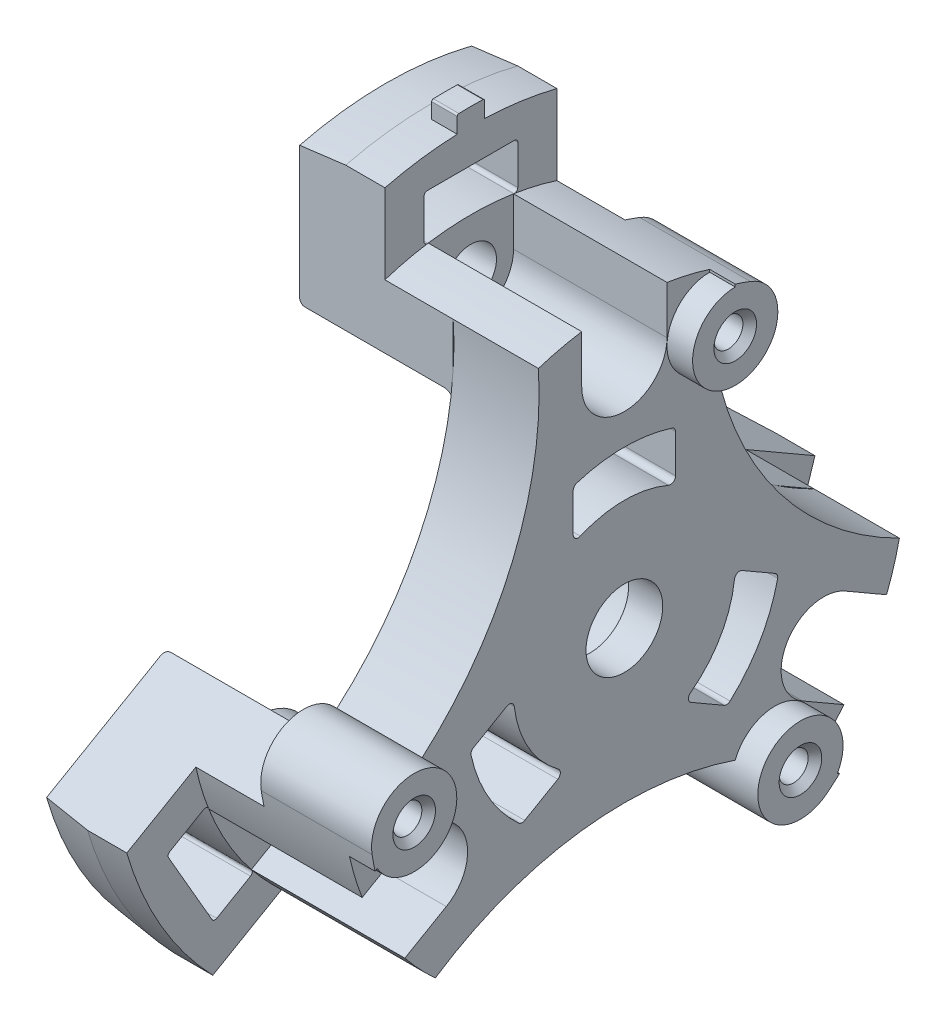
from build123d import *
from build123d.topology import SkipClean

# Parameters (mm, degrees)
SKETCH_2_R                           = 20
CUT_EXTRUDE_1_DEPTH                  = 10
PATTERN_CIRCULAR_1_COUNT             = 3
CUT_EXTRUDE_START                    = -10
CUT_EXTRUDE_2_DEPTH                  = 10
PATTERN_CIRCULAR_2_COUNT             = 3
SKETCH_4_R                           = 1.5
EXTRUDE_1_DEPTH                      = 9
PATTERN_CIRCULAR_3_COUNT             = 3
CUT_EXTRUDE_START_2                  = -1.7
CUT_EXTRUDE_3_DEPTH                  = 1.7
CUT_EXTRUDE_START_3                  = -2.5
CUT_EXTRUDE_8_DEPTH                  = 2.5
PATTERN_CIRCULAR_4_COUNT             = 3
CUT_EXTRUDE_4_DEPTH                  = 9
PATTERN_CIRCULAR_5_COUNT             = 3
EXTRUDE_START                        = -6.5
EXTRUDE_2_DEPTH                      = 6.5
SKETCH_9_R                           = 0.85
CUT_EXTRUDE_7_DEPTH                  = 6.4
CHAMFER_3_SIZE                       = 0.4
PATTERN_CIRCULAR_8_COUNT             = 3
CHAMFER_3_OF_PATTERN_CIRCULAR_8_SIZE = 0.4
CHAMFER_4_SIZE                       = 0.35
CHAMFER_4_SIZE2                      = 0.606217783
FILLET_6_R                           = 0.5
FILLET_7_R                           = 0.5
EXTRUDE_START_2                      = -5
EXTRUDE_3_DEPTH                      = 5
PATTERN_CIRCULAR_9_COUNT             = 3
EXTRUDE_4_DEPTH                      = 1.5
FILLET_9_R                           = 0.3
FILLET_10_R                          = 0.2
FILLET_11_R                          = 0.2


with BuildPart() as part:
    # 草图1 → 旋转1 (revolve)
    with BuildSketch(Plane.XY, mode=Mode.PRIVATE) as revolve_1_sk:
        Polygon((-7, 6.5), (-5, 6.5), (-5, 16.5), (0, 16.5), (0, 2.25), (-2, 2.25), (-2, 4), (-7, 4), align=None)
    revolve(revolve_1_sk.sketch.rotate(Axis((-65.742857143, 0, 0), (1, 0, 0)), 90), axis=Axis((-65.742857143, 0, 0), (1, 0, 0)))

    # 草图2 → 切除-拉伸1 (cut)
    with BuildSketch(Plane.ZY.offset(5)):
        with Locations((-25, 14.43375673)):
            Circle(SKETCH_2_R)
    cut_extrude_1 = extrude(amount=-CUT_EXTRUDE_1_DEPTH, mode=Mode.SUBTRACT)

    # 阵列(圆周)1: 切除-拉伸1 ×3 about axis
    pattern_circular_1_axis = Axis((0, 0, 0), (1, 0, 0))
    for i in range(1, PATTERN_CIRCULAR_1_COUNT):
        add(cut_extrude_1.rotate(pattern_circular_1_axis, i * 360 / PATTERN_CIRCULAR_1_COUNT), mode=Mode.SUBTRACT)

    # 草图3 → 切除-拉伸2 (cut)
    with BuildSketch(Plane.ZY.offset(5).offset(CUT_EXTRUDE_START)):
        with BuildLine():
            Line((-3, 8.480566019), (-3, 6.240993511))
            ThreePointArc((-3, 6.240993511), (-2.864719012, 5.990259295), (-2.580882353, 5.965655562))
            ThreePointArc((-2.580882353, 5.965655562), (0, 6.5), (2.580882353, 5.965655562))
            ThreePointArc((2.580882353, 5.965655562), (2.864719012, 5.990259295), (3, 6.240993511))
            Line((3, 6.240993511), (3, 8.480566019))
            ThreePointArc((3, 8.480566019), (2.9421811, 8.657620571), (2.791011236, 8.766427795))
            ThreePointArc((2.791011236, 8.766427795), (0, 9.2), (-2.791011236, 8.766427795))
            ThreePointArc((-2.791011236, 8.766427795), (-2.9421811, 8.657620571), (-3, 8.480566019))
        make_face()
    cut_extrude_2 = extrude(amount=CUT_EXTRUDE_2_DEPTH, mode=Mode.SUBTRACT)

    # 阵列(圆周)2: 切除-拉伸2 ×3 about axis
    pattern_circular_2_axis = Axis((0, 0, 0), (1, 0, 0))
    for i in range(1, PATTERN_CIRCULAR_2_COUNT):
        add(cut_extrude_2.rotate(pattern_circular_2_axis, i * 360 / PATTERN_CIRCULAR_2_COUNT), mode=Mode.SUBTRACT)

    # 草图4 → 凸台-拉伸1 (add)
    with BuildSketch(Plane.ZY.offset(5)):
        with BuildLine():
            Line((-5.040834524, 15.711142139), (-5.040834524, 11.98290396))
            ThreePointArc((-5.040834524, 11.98290396), (-4.096768005, 12.337604788), (-3.128046355, 12.618055556))
            ThreePointArc((-3.128046355, 12.618055556), (0, 10.25), (3.128046355, 12.618055556))
            ThreePointArc((3.128046355, 12.618055556), (4.096768005, 12.337604788), (5.040834524, 11.98290396))
            Line((5.040834524, 11.98290396), (5.040834524, 15.711142139))
            ThreePointArc((5.040834524, 15.711142139), (0, 16.5), (-5.040834524, 15.711142139))
        make_face()
        with Locations((0, 13.5)):
            Circle(SKETCH_4_R, mode=Mode.SUBTRACT)
    extrude_1 = extrude(amount=EXTRUDE_1_DEPTH)

    # 阵列(圆周)3: 凸台-拉伸1 ×3 about axis
    pattern_circular_3_axis = Axis((0, 0, 0), (1, 0, 0))
    for i in range(1, PATTERN_CIRCULAR_3_COUNT):
        add(extrude_1.rotate(pattern_circular_3_axis, i * 360 / PATTERN_CIRCULAR_3_COUNT))

    # 草图5 → 切除-拉伸3 (cut)
    with BuildSketch(Plane.ZY.offset(14).offset(CUT_EXTRUDE_START_2)):
        with BuildLine():
            Line((-3.25, 12.587195875), (-3.25, 9.290818443))
            Line((-3.25, 9.290818443), (3.25, 9.290818443))
            Line((3.25, 9.290818443), (3.25, 12.587195875))
            ThreePointArc((3.25, 12.587195875), (0, 13), (-3.25, 12.587195875))
        make_face()
    cut_extrude_3 = extrude(amount=CUT_EXTRUDE_3_DEPTH, mode=Mode.SUBTRACT)

    # 草图16 → 切除-拉伸8 (cut)
    with BuildSketch(Plane.ZY.offset(12.3).offset(CUT_EXTRUDE_START_3)):
        with BuildLine():
            ThreePointArc((-2.590612577, 12.739259259), (0, 10.8), (2.590612577, 12.739259259))
            ThreePointArc((2.590612577, 12.739259259), (2.859971605, 12.681504738), (3.128046355, 12.618055556))
            ThreePointArc((3.128046355, 12.618055556), (0, 10.25), (-3.128046355, 12.618055556))
            ThreePointArc((-3.128046355, 12.618055556), (-2.859971605, 12.681504738), (-2.590612577, 12.739259259))
        make_face()
    cut_extrude_8 = extrude(amount=CUT_EXTRUDE_8_DEPTH, mode=Mode.SUBTRACT)

    # 阵列(圆周)4: 切除-拉伸3, 切除-拉伸8 ×3 about axis
    pattern_circular_4_axis = Axis((0, 0, 0), (1, 0, 0))
    add([cut_extrude_3.rotate(pattern_circular_4_axis, i * 360 / PATTERN_CIRCULAR_4_COUNT) for i in range(1, PATTERN_CIRCULAR_4_COUNT)], mode=Mode.SUBTRACT)
    add([cut_extrude_8.rotate(pattern_circular_4_axis, i * 360 / PATTERN_CIRCULAR_4_COUNT) for i in range(1, PATTERN_CIRCULAR_4_COUNT)], mode=Mode.SUBTRACT)

    # 草图6 → 切除-拉伸4 (cut)
    with BuildSketch(Plane(origin=(0, 0, 0), x_dir=(0, 0, -1), z_dir=(1, 0, 0))):
        with BuildLine():
            Line((-2.5, 16.30950643), (-2.5, 13.5))
            ThreePointArc((-2.5, 13.5), (0, 11), (2.5, 13.5))
            Line((2.5, 13.5), (2.5, 16.30950643))
            ThreePointArc((2.5, 16.30950643), (0, 16.5), (-2.5, 16.30950643))
        make_face()
    cut_extrude_4 = extrude(amount=-CUT_EXTRUDE_4_DEPTH, mode=Mode.SUBTRACT)

    # 阵列(圆周)5: 切除-拉伸4 ×3 about axis
    pattern_circular_5_axis = Axis((0, 0, 0), (1, 0, 0))
    for i in range(1, PATTERN_CIRCULAR_5_COUNT):
        add(cut_extrude_4.rotate(pattern_circular_5_axis, i * 360 / PATTERN_CIRCULAR_5_COUNT), mode=Mode.SUBTRACT)

    # 草图7 → 凸台-拉伸2 (add)
    with BuildSketch(Plane.ZY.offset(5).offset(EXTRUDE_START)):
        with BuildLine():
            Line((-5, 15.576696831), (-5, 15.724185194))
            ThreePointArc((-5, 15.724185194), (-5.448667451, 15.574402814), (-5.892857143, 15.411821265))
            ThreePointArc((-5.892857143, 15.411821265), (-4.546023726, 10.618261242), (-5, 15.576696831))
        make_face()
    extrude_2 = extrude(amount=EXTRUDE_2_DEPTH)

    # 草图9 → 切除-拉伸7 (cut)
    with SkipClean():  # the faces are left unmerged after this step: merging them gives an invalid solid
        with BuildSketch(Plane(origin=(1.5, 0, 0), x_dir=(0, 0, -1), z_dir=(1, 0, 0))):
            with Locations((5, 13.076696831)):
                Circle(SKETCH_9_R)
        cut_extrude_7 = extrude(amount=-CUT_EXTRUDE_7_DEPTH, mode=Mode.SUBTRACT)

    # 倒角3
    chamfer_3_edges = [part.edges().sort_by_distance(p)[0] for p in [
        (1.5, 13.076696831, -4.15),
    ]]
    chamfer(chamfer_3_edges, length=CHAMFER_3_SIZE)

    # 阵列(圆周)8: 凸台-拉伸2, 切除-拉伸7 ×3 about axis
    with SkipClean():  # the faces are left unmerged after this step: merging them gives an invalid solid
        pattern_circular_8_axis = Axis((0, 0, 0), (1, 0, 0))
        add([extrude_2.rotate(pattern_circular_8_axis, i * 360 / PATTERN_CIRCULAR_8_COUNT) for i in range(1, PATTERN_CIRCULAR_8_COUNT)])
        add([cut_extrude_7.rotate(pattern_circular_8_axis, i * 360 / PATTERN_CIRCULAR_8_COUNT) for i in range(1, PATTERN_CIRCULAR_8_COUNT)], mode=Mode.SUBTRACT)

    # 倒角3 of 阵列(圆周)8
    chamfer_3_of_pattern_circular_8_edges = [part.edges().sort_by_distance(p)[0] for p in [
        (1.5, -2.94434299, 13.399751653),
        (1.5, -10.132353841, -9.249751653),
    ]]
    chamfer(chamfer_3_of_pattern_circular_8_edges, length=CHAMFER_3_OF_PATTERN_CIRCULAR_8_SIZE)

    # 倒角4
    chamfer_4_edges = [part.edges().sort_by_distance(p)[0] for p in [
        (-7, 0, -4),
    ]]
    chamfer_4_side = [part.faces().sort_by_distance(p)[0] for p in [
        (-7, 0, -4.183847763),
    ]]
    chamfer(chamfer_4_edges, length=CHAMFER_4_SIZE, length2=CHAMFER_4_SIZE2, reference=chamfer_4_side[0])

    # 圆角6
    # the kernel refuses this fillet: 0.5 mm, written as the material it adds along each edge
    with BuildSketch(Plane(origin=(-5, 0, 0), x_dir=(0, 0.8802769898101046, -0.47446013658774416), z_dir=(0, -0.47446013658774416, -0.8802769898101046))) as fillet_6_piece_1_section:
        with BuildLine():
            CenterArc((13 - FILLET_6_R, -FILLET_6_R), FILLET_6_R, 0, 90)
            Line((13, -FILLET_6_R), (13, 0))
            Line((13, 0), (13 - FILLET_6_R, 0))
        make_face()
    fillet_6_piece_1 = revolve(axis=Axis((-5, 0, 0), (1, 0, 0)), revolution_arc=19.910362379, mode=Mode.PRIVATE)
    fillet_6_piece_1 = split(fillet_6_piece_1, bisect_by=Plane(origin=(-5.110824058, 12.210811613, -5.040834524), z_dir=(0, 0, 1)), keep=Keep.TOP, mode=Mode.PRIVATE)
    fillet_6_piece_1 = fillet_6_piece_1 - Plane(origin=(-5.110824058, 13.5, 0), x_dir=(0, 0, 1), z_dir=(1, 0, 0)) * Cylinder(2.5, 52, mode=Mode.PRIVATE)
    add(fillet_6_piece_1)
    with BuildSketch(Plane(origin=(-5, 13.5, 0), x_dir=(0, 0.10999964007655953, 0.9939316270161782), z_dir=(0, 0.9939316270161782, -0.10999964007655953))) as fillet_6_piece_2:
        with BuildLine():
            CenterArc((3.25 + FILLET_6_R, -FILLET_6_R), FILLET_6_R, 90, 90)
            Line((3.25, -FILLET_6_R), (3.25, 0))
            Line((3.25, 0), (3.25 + FILLET_6_R, 0))
        make_face()
    revolve(axis=Axis((-5, 13.5, 0), (1, 0, 0)), revolution_arc=192.630589643)
    with BuildSketch(Plane(origin=(-5, 0, 0), x_dir=(0, 0.9892370095213199, 0.14632203864529783), z_dir=(0, 0.14632203864529783, -0.9892370095213199))) as fillet_6_piece_3_section:
        with BuildLine():
            CenterArc((13 - FILLET_6_R, -FILLET_6_R), FILLET_6_R, 0, 90)
            Line((13, -FILLET_6_R), (13, 0))
            Line((13, 0), (13 - FILLET_6_R, 0))
        make_face()
    fillet_6_piece_3 = revolve(axis=Axis((-5, 0, 0), (1, 0, 0)), revolution_arc=19.910362379, mode=Mode.PRIVATE)
    fillet_6_piece_3 = split(fillet_6_piece_3, bisect_by=Plane(origin=(-5.110824602, 12.21081128, 5.040834524), z_dir=(0, 0, -1)), keep=Keep.TOP, mode=Mode.PRIVATE)
    fillet_6_piece_3 = fillet_6_piece_3 - Plane(origin=(-5.110824602, 13.5, 0), x_dir=(0, 0, 1), z_dir=(1, 0, 0)) * Cylinder(2.5, 52, mode=Mode.PRIVATE)
    add(fillet_6_piece_3)
    with BuildSketch(Plane(origin=(-5, 0, 0), x_dir=(0, -0.8510330262730736, -0.5251121672485737), z_dir=(0, -0.5251121672485737, 0.8510330262730736))) as fillet_6_piece_4_section:
        with BuildLine():
            CenterArc((13 - FILLET_6_R, -FILLET_6_R), FILLET_6_R, 0, 90)
            Line((13, -FILLET_6_R), (13, 0))
            Line((13, 0), (13 - FILLET_6_R, 0))
        make_face()
    fillet_6_piece_4 = revolve(axis=Axis((-5, 0, 0), (1, 0, 0)), revolution_arc=19.910362379, mode=Mode.PRIVATE)
    fillet_6_piece_4 = split(fillet_6_piece_4, bisect_by=Plane(origin=(-5.110824058, -10.47089656, -8.054455796), z_dir=(0, 0.8660254037844384, -0.5000000000000004)), keep=Keep.TOP, mode=Mode.PRIVATE)
    fillet_6_piece_4 = fillet_6_piece_4 - Plane(origin=(-5.110824058, -6.75, -11.691342951), x_dir=(0, 0.8660254037844384, -0.5000000000000004), z_dir=(1, 0, 0)) * Cylinder(2.5, 52, mode=Mode.PRIVATE)
    add(fillet_6_piece_4)
    with BuildSketch(Plane(origin=(-5, -6.75, -11.691342951), x_dir=(0, 0.8057702185825306, -0.5922282962215338), z_dir=(0, -0.5922282962215338, -0.8057702185825306))) as fillet_6_piece_5:
        with BuildLine():
            CenterArc((3.25 + FILLET_6_R, -FILLET_6_R), FILLET_6_R, 90, 90)
            Line((3.25, -FILLET_6_R), (3.25, 0))
            Line((3.25, 0), (3.25 + FILLET_6_R, 0))
        make_face()
    revolve(axis=Axis((-5, -6.75, -11.691342951), (1, 0, 0)), revolution_arc=192.630589643)
    with BuildSketch(Plane(origin=(-5, 0, 0), x_dir=(0, -0.36789990216030416, -0.9298653999318603), z_dir=(0, -0.9298653999318603, 0.36789990216030416))) as fillet_6_piece_6_section:
        with BuildLine():
            CenterArc((13 - FILLET_6_R, -FILLET_6_R), FILLET_6_R, 0, 90)
            Line((13, -FILLET_6_R), (13, 0))
            Line((13, 0), (13 - FILLET_6_R, 0))
        make_face()
    fillet_6_piece_6 = revolve(axis=Axis((-5, 0, 0), (1, 0, 0)), revolution_arc=19.910362379, mode=Mode.PRIVATE)
    fillet_6_piece_6 = split(fillet_6_piece_6, bisect_by=Plane(origin=(-5.110824602, -1.739914886, -13.095290031), z_dir=(0, -0.8660254037844384, 0.5000000000000004)), keep=Keep.TOP, mode=Mode.PRIVATE)
    fillet_6_piece_6 = fillet_6_piece_6 - Plane(origin=(-5.110824602, -6.75, -11.691342951), x_dir=(0, 0.8660254037844384, -0.5000000000000004), z_dir=(1, 0, 0)) * Cylinder(2.5, 52, mode=Mode.PRIVATE)
    add(fillet_6_piece_6)
    with BuildSketch(Plane(origin=(-5, 0, 0), x_dir=(0, -0.029243963537030883, 0.9995723038363181), z_dir=(0, 0.9995723038363181, 0.029243963537030883))) as fillet_6_piece_7_section:
        with BuildLine():
            CenterArc((13 - FILLET_6_R, -FILLET_6_R), FILLET_6_R, 0, 90)
            Line((13, -FILLET_6_R), (13, 0))
            Line((13, 0), (13 - FILLET_6_R, 0))
        make_face()
    fillet_6_piece_7 = revolve(axis=Axis((-5, 0, 0), (1, 0, 0)), revolution_arc=19.910362379, mode=Mode.PRIVATE)
    fillet_6_piece_7 = split(fillet_6_piece_7, bisect_by=Plane(origin=(-5.110824058, -1.739915053, 13.095290319), z_dir=(0, -0.8660254037844388, -0.49999999999999983)), keep=Keep.TOP, mode=Mode.PRIVATE)
    fillet_6_piece_7 = fillet_6_piece_7 - Plane(origin=(-5.110824058, -6.75, 11.691342951), x_dir=(0, -0.8660254037844388, -0.49999999999999983), z_dir=(1, 0, 0)) * Cylinder(2.5, 52, mode=Mode.PRIVATE)
    add(fillet_6_piece_7)
    with BuildSketch(Plane(origin=(-5, -6.75, 11.691342951), x_dir=(0, -0.9157698586590889, -0.4017033307946455), z_dir=(0, -0.4017033307946455, 0.9157698586590889))) as fillet_6_piece_8:
        with BuildLine():
            CenterArc((3.25 + FILLET_6_R, -FILLET_6_R), FILLET_6_R, 90, 90)
            Line((3.25, -FILLET_6_R), (3.25, 0))
            Line((3.25, 0), (3.25 + FILLET_6_R, 0))
        make_face()
    revolve(axis=Axis((-5, -6.75, 11.691342951), (1, 0, 0)), revolution_arc=192.630589643)
    with BuildSketch(Plane(origin=(-5, 0, 0), x_dir=(0, -0.6213371073610158, 0.783543361286563), z_dir=(0, 0.783543361286563, 0.6213371073610158))) as fillet_6_piece_9_section:
        with BuildLine():
            CenterArc((13 - FILLET_6_R, -FILLET_6_R), FILLET_6_R, 0, 90)
            Line((13, -FILLET_6_R), (13, 0))
            Line((13, 0), (13 - FILLET_6_R, 0))
        make_face()
    fillet_6_piece_9 = revolve(axis=Axis((-5, 0, 0), (1, 0, 0)), revolution_arc=19.910362379, mode=Mode.PRIVATE)
    fillet_6_piece_9 = split(fillet_6_piece_9, bisect_by=Plane(origin=(-5.110824602, -10.470896394, 8.054455508), z_dir=(0, 0.8660254037844388, 0.49999999999999983)), keep=Keep.TOP, mode=Mode.PRIVATE)
    fillet_6_piece_9 = fillet_6_piece_9 - Plane(origin=(-5.110824602, -6.75, 11.691342951), x_dir=(0, -0.8660254037844388, -0.49999999999999983), z_dir=(1, 0, 0)) * Cylinder(2.5, 52, mode=Mode.PRIVATE)
    add(fillet_6_piece_9)

    # 圆角7
    fillet_7_edges = [part.edges().sort_by_distance(p)[0] for p in [
        (-7, 0, -6.5),
    ]]
    fillet(fillet_7_edges, radius=FILLET_7_R)

    # 草图11 → 凸台-拉伸3 (add)
    with BuildSketch(Plane.ZY.offset(14).offset(EXTRUDE_START_2)):
        with BuildLine():
            Line((-5.040834524, 15.711142139), (-5.040834524, 20.386024313))
            ThreePointArc((-5.040834524, 20.386024313), (-2.539044054, 20.845940979), (0, 21))
            ThreePointArc((0, 21), (2.539044054, 20.845940979), (5.040834524, 20.386024313))
            Line((5.040834524, 20.386024313), (5.040834524, 15.711142139))
            ThreePointArc((5.040834524, 15.711142139), (3.905398597, 16.031152853), (2.75, 16.269219404))
            Line((2.75, 16.269219404), (2.75, 18.8))
            ThreePointArc((2.75, 18.8), (2.691421356, 18.941421356), (2.55, 19))
            Line((2.55, 19), (-2.55, 19))
            ThreePointArc((-2.55, 19), (-2.691421356, 18.941421356), (-2.75, 18.8))
            Line((-2.75, 18.8), (-2.75, 16.269219404))
            ThreePointArc((-2.75, 16.269219404), (-3.905398597, 16.031152853), (-5.040834524, 15.711142139))
        make_face()
    extrude_3 = extrude(amount=EXTRUDE_3_DEPTH)

    # 阵列(圆周)9: 凸台-拉伸3 ×3 about axis
    pattern_circular_9_axis = Axis((0, 0, 0), (1, 0, 0))
    for i in range(1, PATTERN_CIRCULAR_9_COUNT):
        add(extrude_3.rotate(pattern_circular_9_axis, i * 360 / PATTERN_CIRCULAR_9_COUNT))

    # 草图12 → 凸台-拉伸4 (add)
    with BuildSketch(Plane(origin=(-9, 0, 0), x_dir=(0, 0, -1), z_dir=(1, 0, 0))):
        with BuildLine():
            Line((-0.8, 21.888809927), (-0.8, 20.984756372))
            ThreePointArc((-0.8, 20.984756372), (0, 21), (0.8, 20.984756372))
            Line((0.8, 20.984756372), (0.8, 21.888809927))
            ThreePointArc((0.8, 21.888809927), (0.771831869, 21.958381348), (0.703196347, 21.98875883))
            ThreePointArc((0.703196347, 21.98875883), (0, 22), (-0.703196347, 21.98875883))
            ThreePointArc((-0.703196347, 21.98875883), (-0.771831869, 21.958381348), (-0.8, 21.888809927))
        make_face()
    extrude(amount=-EXTRUDE_4_DEPTH)

    # 圆角9
    fillet_9_edges = [part.edges().sort_by_distance(p)[0] for p in [
        (-14, 12.587782675, -3.247726485),
        (-14, 12.587782675, 3.247726485),
        (-14, -9.106504978, -9.277476331),
        (-14, -3.481277697, -12.525202817),
        (-14, -3.481277697, 12.525202817),
        (-14, -9.106504978, 9.277476331),
    ]]
    fillet(fillet_9_edges, radius=FILLET_9_R)

    # 圆角10
    fillet_10_edges = [part.edges().sort_by_distance(p)[0] for p in [
        (-11.5, 16.269219404, -2.75),
        (-11.5, 16.269219404, 2.75),
        (-11.5, -10.516179562, -12.714557303),
        (-11.5, -5.753039841, -15.464557303),
        (-11.5, -5.753039841, 15.464557303),
        (-11.5, -10.516179562, 12.714557303),
    ]]
    fillet(fillet_10_edges, radius=FILLET_10_R)

    # 草图15 → 切除-旋转2 (revolve, cut)
    with BuildSketch(Plane.XY, mode=Mode.PRIVATE) as cut_revolve_2_sk:
        Polygon((-16.107755243, 21), (-11.3, 21), (-16.107755243, 20.409681884), align=None)
    revolve(cut_revolve_2_sk.sketch.rotate(Axis((8.388965583, 0, 0), (-1, 0, 0)), 263.394439623), axis=Axis((8.388965583, 0, 0), (-1, 0, 0)), mode=Mode.SUBTRACT)

    # 圆角11
    fillet_11_edges = [part.edges().sort_by_distance(p)[0] for p in [
        (-9.8, 10.8, 0),
        (-9.8, -5.4, 9.353074361),
        (-9.8, -5.4, -9.353074361),
    ]]
    fillet(fillet_11_edges, radius=FILLET_11_R)


solid = part.part
